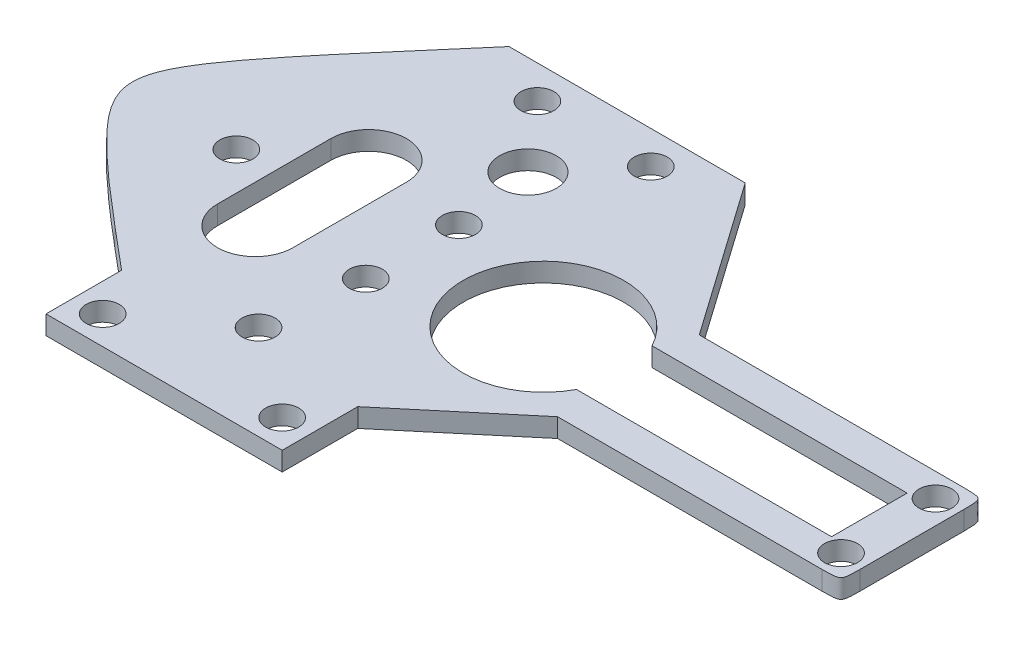
from build123d import *

# Parameters (mm, degrees)
SKETCH1_R           = 1.75
BOSS_EXTRUDE1_DEPTH = 2
FILLET3_SIZE        = 2
SKETCH2_R           = 1.75
SKETCH2_R_2         = 3
CUT_EXTRUDE1_DEPTH  = 60.602891692


with BuildPart() as part:
    # Sketch1 → Boss-Extrude1 (new body)
    with BuildSketch(Plane(origin=(0, 0, 0), x_dir=(1, 0, 0), z_dir=(0, 1, 0))):
        Polygon((12.5, -17.149645759), (24, -7.5), (54, -7.5), (54, 7.5), (24, 7.5), (12.5, 23.863068172), (-12.5, 23.863068172), (-32.938151944, 0), (-12.5, -17.149645759), (-12.5, -25.149645759), (12.5, -25.149645759), align=None)
        with Locations(Location((51.5, -5, 0), (0, 0, 270))):
            Circle(SKETCH1_R, mode=Mode.SUBTRACT)
        with Locations(Location((51.5, 5, 0), (0, 0, 90))):
            Circle(SKETCH1_R, mode=Mode.SUBTRACT)
        with BuildLine():
            Line((22.5, 4), (49.5, 4))
            Line((49.5, 4), (49.5, -4))
            Line((49.5, -4), (22.5, -4))
            ThreePointArc((22.5, -4), (6.5, 0), (22.5, 4))
        make_face(mode=Mode.SUBTRACT)
    extrude(amount=BOSS_EXTRUDE1_DEPTH)

    # Fillet2
    # a fillet whose section is not a circle: 21 mm, written as the material it takes off along each edge
    with BuildSketch(Plane(origin=(-32.938151944, -53.033486064, 0), x_dir=(0.650499477323288, 0, -0.7595067017493191), z_dir=(0, 1, 0))) as fillet2_piece_1:
        with BuildLine():
            Bezier((21.213394426, 0), (0, 0), (0.214467683, -21.212310262), weights=[1, 3, 1])
            Line((0.214467683, -21.212310262), (0, 0))
            Line((0, 0), (21.213394426, 0))
        make_face()
    extrude(amount=108.066972128, mode=Mode.SUBTRACT)

    # Fillet3
    # a fillet whose section is not a circle: 2 mm, written as the material it takes off along each edge
    with BuildSketch(Plane(origin=(54, -5, -7.5), x_dir=(0, 0, 1), z_dir=(0, 1, 0)), Plane(origin=(54, -5, 7.5), x_dir=(-1, 0, 0), z_dir=(0, 1, 0))) as fillet3_piece_1:
        with BuildLine():
            Bezier((FILLET3_SIZE, 0), (0, 0), (0, -FILLET3_SIZE), weights=[1, 3, 1])
            Line((0, -FILLET3_SIZE), (0, 0))
            Line((0, 0), (FILLET3_SIZE, 0))
        make_face()
    extrude(amount=12, mode=Mode.SUBTRACT)

    # Sketch2 → Cut-Extrude1 (cut, through all)
    with BuildSketch(Plane(origin=(0, 2, 0), x_dir=(1, 0, 0), z_dir=(0, 1, 0))):
        with Locations(Location((-9.5, -22.149645759, 0), (0, 0, 270))):
            Circle(SKETCH2_R)
        with Locations(Location((9.5, -22.149645759, 0), (0, 0, 270))):
            Circle(SKETCH2_R)
        with Locations(Location((6, 20.363068172, 0), (0, 0, 270))):
            Circle(SKETCH2_R)
        with Locations(Location((-6, 20.363068172, 0), (0, 0, 270))):
            Circle(SKETCH2_R)
        with Locations(Location((0, -15.149645759, 0), (0, 0, 270))):
            Circle(SKETCH2_R)
        with Locations(Location((-17.5, 0, 0), (0, 0, 270))):
            Circle(SKETCH2_R)
        with Locations(Location((1.200212435, 4.853811915, 0), (0, 0, 270))):
            Circle(SKETCH2_R)
        with Locations(Location((0, 13.363068172, 0), (0, 0, 270))):
            Circle(SKETCH2_R_2)
        with Locations(Location((1.2, -5, 0), (0, 0, 270))):
            Circle(SKETCH2_R)
        with BuildLine():
            Line((-5.5, 6), (-5.5, -6))
            ThreePointArc((-5.5, -6), (-9.5, -10), (-13.5, -6))
            Line((-13.5, -6), (-13.5, 6))
            ThreePointArc((-13.5, 6), (-9.5, 10), (-5.5, 6))
        make_face()
    extrude(amount=-CUT_EXTRUDE1_DEPTH, mode=Mode.SUBTRACT)


solid = part.part
